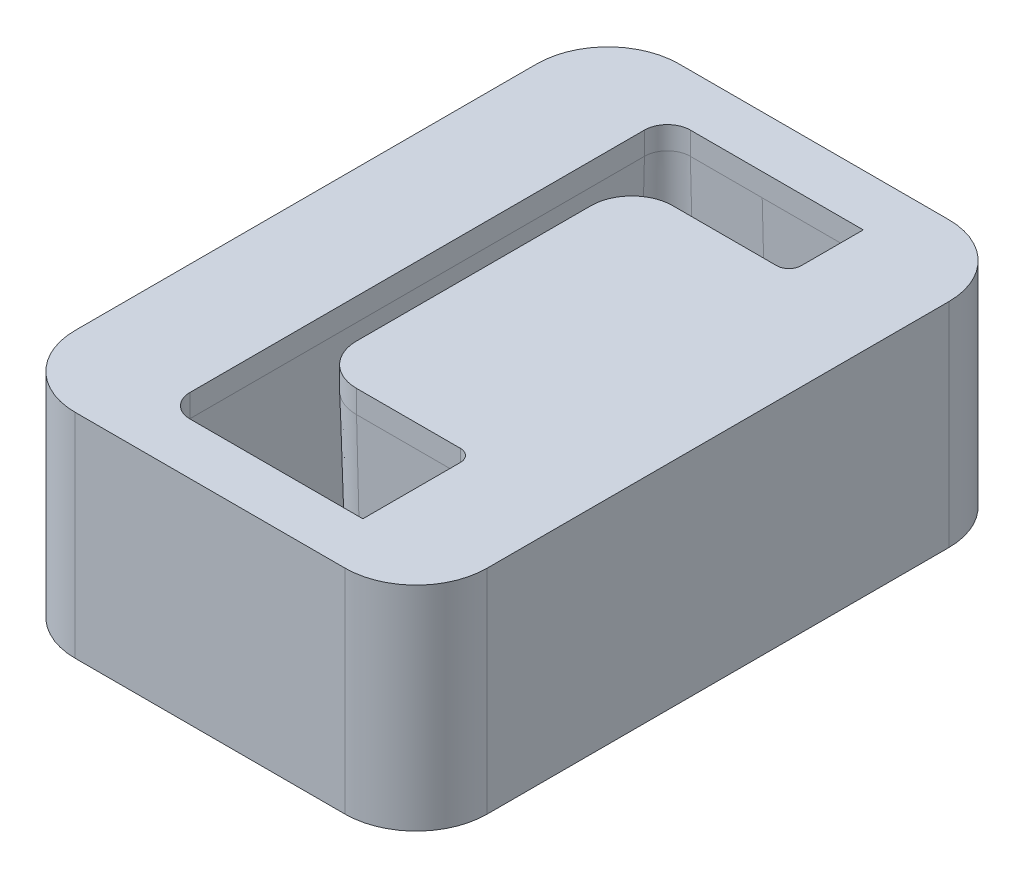
from build123d import *

# Parameters (mm, degrees)
SKETCH1_W                   = 58
SKETCH1_H                   = 85
BOSS_EXTRUDE1_DEPTH         = 30
FILLET1_R                   = 10
CUT_EXTRUDE1_REACH          = 61.559
M6_TAPPED_HOLE1_D           = 5
M6_TAPPED_HOLE1_DEPTH       = 17
M6_TAPPED_HOLE1_CSINK_D     = 6.05
M6_TAPPED_HOLE1_CSINK_ANGLE = 90
M6_TAPPED_HOLE1_TIP         = 1.502151548


with BuildPart() as part:
    # Sketch1 → Boss-Extrude1 (new body)
    with BuildSketch(Plane(origin=(0, 0, 0), x_dir=(1, 0, 0), z_dir=(0, 1, 0))):
        Rectangle(SKETCH1_W, SKETCH1_H)
    extrude(amount=-BOSS_EXTRUDE1_DEPTH)

    # Fillet1
    fillet1_edges = [part.edges().sort_by_distance(p)[0] for p in [
        (-29, -15, -42.5),
        (29, -15, -42.5),
        (29, -15, 42.5),
        (-29, -15, 42.5),
    ]]
    fillet(fillet1_edges, radius=FILLET1_R)

    # Sketch2 → Cut-Extrude1 (cut, up to next)
    with BuildSketch(Plane(origin=(0, 0, 0), x_dir=(1, 0, 0), z_dir=(0, 1, 0)), mode=Mode.PRIVATE) as cut_extrude1_sk1:
        with BuildLine():
            Line((14.23, 35.23), (-10.12, 35.23))
            ThreePointArc((-10.12, 35.23), (-12.403954903, 34.283954903), (-13.35, 32))
            Line((-13.35, 32), (-13.35, -32))
            ThreePointArc((-13.35, -32), (-12.403954903, -34.283954903), (-10.12, -35.23))
            Line((-10.12, -35.23), (14.23, -35.23))
            Line((14.23, -35.23), (14.23, -21.5))
            ThreePointArc((14.23, -21.5), (13.723294731, -20.276705269), (12.5, -19.77))
            Line((12.5, -19.77), (-2.12, -19.77))
            ThreePointArc((-2.12, -19.77), (-6.200006127, -18.080006127), (-7.89, -14))
            Line((-7.89, -14), (-7.89, 19))
            ThreePointArc((-7.89, 19), (-6.200006127, 23.080006127), (-2.12, 24.77))
            Line((-2.12, 24.77), (12.5, 24.77))
            ThreePointArc((12.5, 24.77), (13.723294731, 25.276705269), (14.23, 26.5))
            Line((14.23, 26.5), (14.23, 35.23))
        make_face()
    cut_extrude1_tool1 = extrude(cut_extrude1_sk1.sketch, amount=-CUT_EXTRUDE1_REACH, mode=Mode.PRIVATE) & part.part
    add(cut_extrude1_tool1.solids().sort_by_distance((13.188259, 0, -25.811741))[0], mode=Mode.SUBTRACT)

    # Cut-Sweep1: sweep along a path in Sketch5
    with BuildLine(Plane(origin=(0, 0, 0), x_dir=(1, 0, 0), z_dir=(0, 1, 0))) as cut_sweep1_path:
        Line((12.5, -19.77), (-2.12, -19.77))
        ThreePointArc((-2.12, -19.77), (-6.200006127, -18.080006127), (-7.89, -14))
        Line((-7.89, -14), (-7.89, 19))
        ThreePointArc((-7.89, 19), (-6.200006127, 23.080006127), (-2.12, 24.77))
        Line((-2.12, 24.77), (12.5, 24.77))
        ThreePointArc((12.5, 24.77), (13.723294731, 25.276705269), (14.23, 26.5))
        Line((14.23, 26.5), (14.23, 35.23))
        Line((14.23, 35.23), (-10.12, 35.23))
        ThreePointArc((-10.12, 35.23), (-12.403954903, 34.283954903), (-13.35, 32))
        Line((-13.35, 32), (-13.35, -32))
        ThreePointArc((-13.35, -32), (-12.403954903, -34.283954903), (-10.12, -35.23))
        Line((-10.12, -35.23), (14.23, -35.23))
        Line((14.23, -35.23), (14.23, -21.5))
        ThreePointArc((14.23, -21.5), (13.723294731, -20.276705269), (12.5, -19.77))
    # Sketch3 → Cut-Sweep1 (sweep, cut)
    with BuildSketch(Plane(origin=(0, 0, 0), x_dir=(0, 0, -1), z_dir=(1, 0, 0))):
        Polygon((35.23, -3.2), (35.931782698, -30), (35.23, -30), align=None)
    sweep(path=cut_sweep1_path.line, transition=Transition.RIGHT, mode=Mode.SUBTRACT)

    # M6 Tapped Hole1
    with Locations(Plane(origin=(0, -30, 0), x_dir=(-1, 0, 0), z_dir=(0, -1, 0))):
        with Locations((-22, 35.5), (22, 35.5), (22, -35.5), (-22, -35.5)):
            CounterSinkHole(M6_TAPPED_HOLE1_D / 2, M6_TAPPED_HOLE1_CSINK_D / 2, depth=M6_TAPPED_HOLE1_DEPTH, counter_sink_angle=M6_TAPPED_HOLE1_CSINK_ANGLE)
            with Locations((0, 0, -(M6_TAPPED_HOLE1_DEPTH + M6_TAPPED_HOLE1_TIP / 2))):  # 118° drill point
                Cone(0, M6_TAPPED_HOLE1_D / 2, M6_TAPPED_HOLE1_TIP, mode=Mode.SUBTRACT)


solid = part.part
